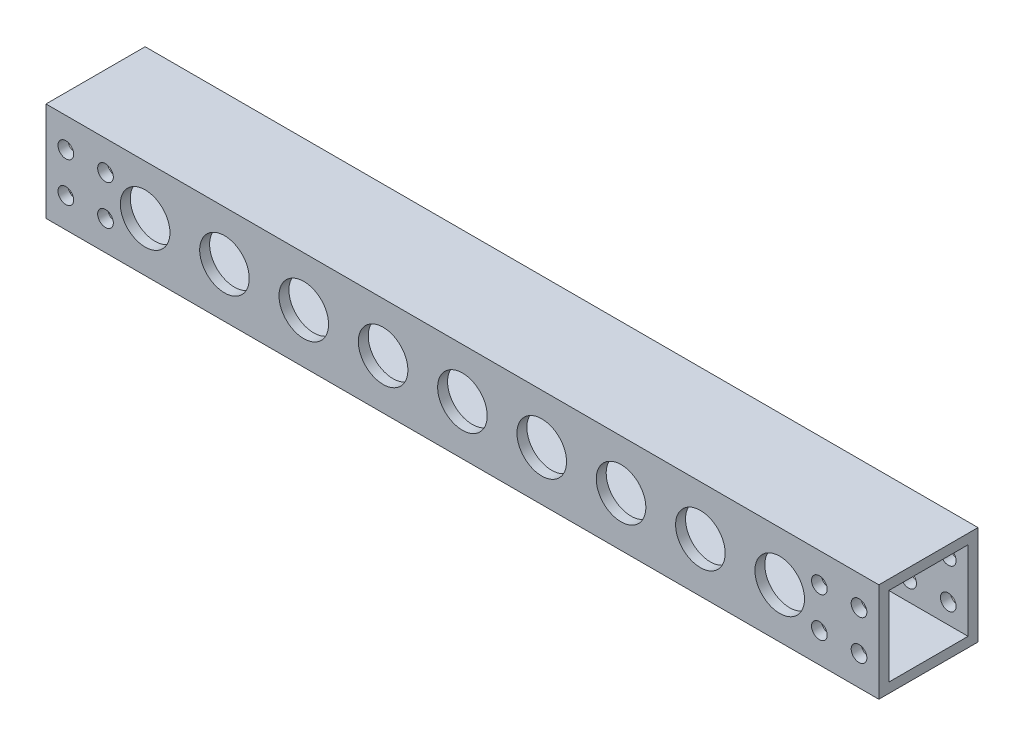
from build123d import *

# Parameters (mm, degrees)
SKETCH1_W           = 266.7
SKETCH1_H           = 31.75
BOSS_EXTRUDE1_DEPTH = 31.75
SKETCH2_R           = 7.9375
CUT_EXTRUDE1_DEPTH  = 31.75
LPATTERN1_COUNT     = 9
LPATTERN1_PITCH     = 25.4
SKETCH3_R           = 2.50825
CUT_EXTRUDE2_DEPTH  = 31.75
SKETCH4_W           = 25.4
SKETCH4_H           = 25.4
CUT_EXTRUDE3_DEPTH  = 266.7


with BuildPart() as part:
    # Sketch1 → Boss-Extrude1 (new body)
    with BuildSketch(Plane.XY):
        with Locations((-133.35, -15.875)):
            Rectangle(SKETCH1_W, SKETCH1_H)
    extrude(amount=BOSS_EXTRUDE1_DEPTH)

    # Sketch2 → Cut-Extrude1 (cut)
    with BuildSketch(Plane.XY.offset(31.75)):
        with Locations((-234.95, -15.875)):
            Circle(SKETCH2_R)
    cut_extrude1 = extrude(amount=-CUT_EXTRUDE1_DEPTH, mode=Mode.SUBTRACT)

    # LPattern1: Cut-Extrude1 ×9
    with Locations(*[(i * LPATTERN1_PITCH, 0, 0) for i in range(1, LPATTERN1_COUNT)]):
        add(cut_extrude1, mode=Mode.SUBTRACT)

    # Sketch3 → Cut-Extrude2 (cut)
    with BuildSketch(Plane.XY.offset(31.75)):
        with Locations((-260.35, -9.525)):
            Circle(SKETCH3_R)
        with Locations((-247.65, -9.525)):
            Circle(SKETCH3_R)
        with Locations((-260.35, -22.225)):
            Circle(SKETCH3_R)
        with Locations((-247.65, -22.225)):
            Circle(SKETCH3_R)
    cut_extrude2 = extrude(amount=-CUT_EXTRUDE2_DEPTH, mode=Mode.SUBTRACT)

    # Sketch4 → Cut-Extrude3 (cut)
    with BuildSketch(Plane(origin=(0, 0, 0), x_dir=(0, 0, -1), z_dir=(1, 0, 0))):
        with Locations((-15.875, -15.875)):
            Rectangle(SKETCH4_W, SKETCH4_H)
    extrude(amount=-CUT_EXTRUDE3_DEPTH, mode=Mode.SUBTRACT)

    # Mirror1: Cut-Extrude2 across plane
    add(cut_extrude2.mirror(Plane(origin=(-133.35, 0, 0), x_dir=(0, 0, 1), z_dir=(1, 0, 0))), mode=Mode.SUBTRACT)


solid = part.part
